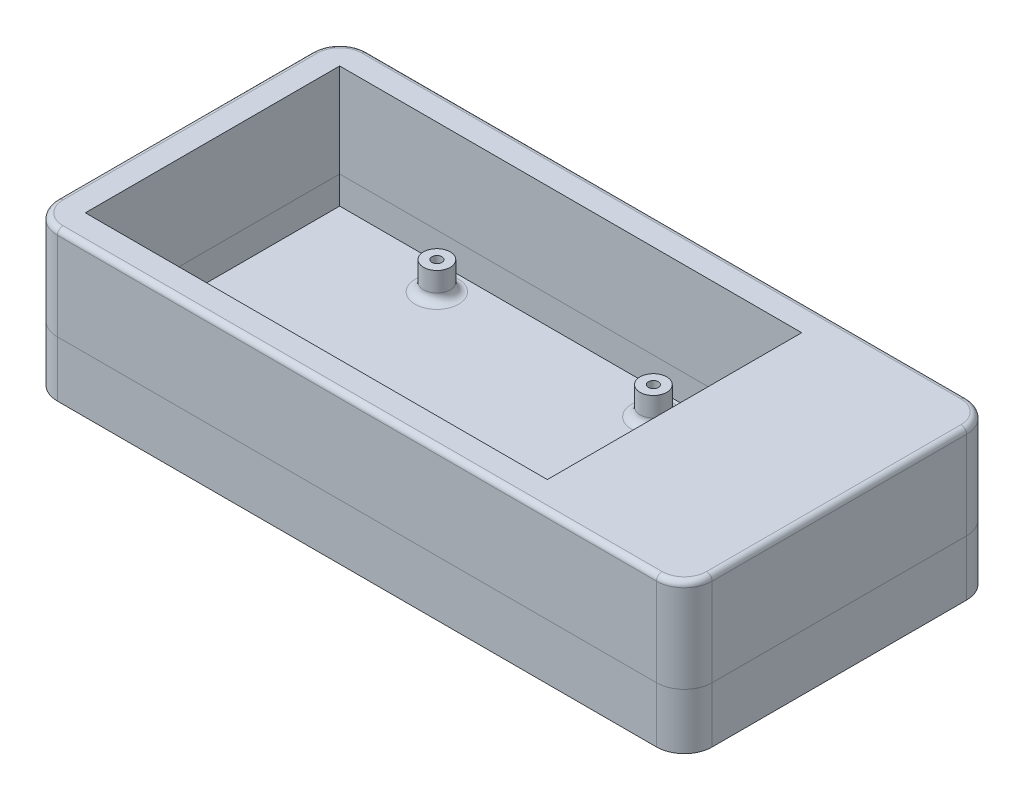
from build123d import *

# Parameters (mm, degrees)
BOSS_EXTRUDE2_DEPTH    = 26.8
SKETCH2_W              = 107.6
SKETCH2_H              = 45.69
CUT_EXTRUDE2_DEPTH     = 21.8
SKETCH3_R              = 2.4
SKETCH3_R_2            = 0.9
BOSS_EXTRUDE3_DEPTH    = 5
FILLET3_R              = 1
FILLET5_R              = 1.5
FILLET6_R              = 1.5
FILLET7_R              = 1.5
BOSS_EXTRUDE4_REACH    = 91.152
SKETCH10_W             = 24.61
SKETCH10_H             = 5
CUT_EXTRUDE3_DEPTH     = 5
SPLIT1_SURFACE_1_BACK  = 133.851
SPLIT1_SURFACE_1_DEPTH = 267.702
SPLIT1_SURFACE_2_BACK  = 133.851
SPLIT1_SURFACE_2_DEPTH = 267.702


with BuildPart() as part:
    # Sketch1 → Boss-Extrude2 (new body)
    with BuildSketch(Plane(origin=(0, 0, 0), x_dir=(1, 0, 0), z_dir=(0, 1, 0))):
        with BuildLine():
            Line((-44.333718436, 25.104825802), (63.266281564, 25.104825802))
            ThreePointArc((63.266281564, 25.104825802), (66.80181547, 23.640359708), (68.266281564, 20.104825802))
            Line((68.266281564, 20.104825802), (68.266281564, -25.585174198))
            ThreePointArc((68.266281564, -25.585174198), (66.80181547, -29.120708104), (63.266281564, -30.585174198))
            Line((63.266281564, -30.585174198), (-44.333718436, -30.585174198))
            ThreePointArc((-44.333718436, -30.585174198), (-47.869252342, -29.120708104), (-49.333718436, -25.585174198))
            Line((-49.333718436, -25.585174198), (-49.333718436, 20.104825802))
            ThreePointArc((-49.333718436, 20.104825802), (-47.869252342, 23.640359708), (-44.333718436, 25.104825802))
        make_face()
    extrude(amount=BOSS_EXTRUDE2_DEPTH)

    # Sketch2 → Cut-Extrude2 (cut)
    with BuildSketch(Plane(origin=(0, 26.8, 0), x_dir=(1, 0, 0), z_dir=(0, 1, 0))):
        with Locations((9.466281564, -2.740174198)):
            Rectangle(SKETCH2_W, SKETCH2_H)
    extrude(amount=-CUT_EXTRUDE2_DEPTH, mode=Mode.SUBTRACT)

    # Sketch3 → Boss-Extrude3 (add)
    # profile 1 of 3: a face of its own
    with BuildSketch(Plane(origin=(0, 5, 0), x_dir=(1, 0, 0), z_dir=(0, 1, 0))):
        with Locations((-22.283718436, 15.514825802)):
            Circle(SKETCH3_R)
        with Locations((-22.283718436, 15.514825802)):
            Circle(SKETCH3_R_2, mode=Mode.SUBTRACT)
    # profile 2 of 3: a face of its own
    with BuildSketch(Plane(origin=(0, 5, 0), x_dir=(1, 0, 0), z_dir=(0, 1, 0))):
        with Locations((16.606281564, 15.514825802)):
            Circle(SKETCH3_R)
        with Locations((16.606281564, 15.514825802)):
            Circle(SKETCH3_R_2, mode=Mode.SUBTRACT)
    # profile 3 of 3: a face of its own
    with BuildSketch(Plane(origin=(0, 5, 0), x_dir=(1, 0, 0), z_dir=(0, 1, 0))):
        with Locations((-2.443718436, -20.995174198)):
            Circle(SKETCH3_R)
        with Locations((-2.443718436, -20.995174198)):
            Circle(SKETCH3_R_2, mode=Mode.SUBTRACT)
    extrude(amount=BOSS_EXTRUDE3_DEPTH)

    # Fillet3
    fillet3_edges = [part.edges().sort_by_distance(p)[0] for p in [
        (-47.869252342, 26.8, 29.120708104),
        (-47.869252342, 26.8, -23.640359708),
        (66.80181547, 26.8, -23.640359708),
        (66.80181547, 26.8, 29.120708104),
        (9.466281564, 26.8, -25.104825802),
        (-49.333718436, 26.8, 2.740174198),
        (68.266281564, 26.8, 2.740174198),
        (9.466281564, 26.8, 30.585174198),
    ]]
    fillet(fillet3_edges, radius=FILLET3_R)

    # Fillet5
    fillet5_edges = [part.edges().sort_by_distance(p)[0] for p in [
        (14.206281564, 5, -15.514825802),
    ]]
    fillet(fillet5_edges, radius=FILLET5_R)

    # Fillet6
    fillet6_edges = [part.edges().sort_by_distance(p)[0] for p in [
        (-24.683718436, 5, -15.514825802),
    ]]
    fillet(fillet6_edges, radius=FILLET6_R)

    # Fillet7
    fillet7_edges = [part.edges().sort_by_distance(p)[0] for p in [
        (-4.843718436, 5, 20.995174198),
    ]]
    fillet(fillet7_edges, radius=FILLET7_R)

    # Sketch10 → Boss-Extrude4 (add, up to next)
    with BuildSketch(Plane.XY.offset(-20.104825802), mode=Mode.PRIVATE) as boss_extrude4_sk1:
        with Locations((50.961281564, 24.3)):
            Rectangle(SKETCH10_W, SKETCH10_H)
    boss_extrude4_tool1 = extrude(boss_extrude4_sk1.sketch, amount=BOSS_EXTRUDE4_REACH, mode=Mode.PRIVATE) - part.part
    add(boss_extrude4_tool1.solids().sort_by_distance((50.961282, 24.3, -20.104826))[0])

    # Sketch13 → Cut-Extrude3 (cut)
    with BuildSketch(Plane.XY.offset(-20.104825802)):
        with BuildLine():
            Line((42.126281564, 11), (52.626281564, 11))
            ThreePointArc((52.626281564, 11), (52.979834955, 10.853553391), (53.126281564, 10.5))
            Line((53.126281564, 10.5), (53.126281564, 7.2))
            ThreePointArc((53.126281564, 7.2), (52.979834955, 6.846446609), (52.626281564, 6.7))
            Line((52.626281564, 6.7), (42.126281564, 6.7))
            ThreePointArc((42.126281564, 6.7), (41.772728174, 6.846446609), (41.626281564, 7.2))
            Line((41.626281564, 7.2), (41.626281564, 10.5))
            ThreePointArc((41.626281564, 10.5), (41.772728174, 10.853553391), (42.126281564, 11))
        make_face()
    extrude(amount=-CUT_EXTRUDE3_DEPTH, mode=Mode.SUBTRACT)


with BuildPart() as body_2:
    # Split1: the piece behind the surface
    add(part.part)
    # Split1 surface: a surface, the sketch's curves swept straight by 267.702 mm
    with BuildLine(Plane.XY.offset(-20.104825802).offset(-SPLIT1_SURFACE_1_BACK), mode=Mode.PRIVATE) as split1_surface_1_path:
        Line((-49.333718436, 10), (68.266281564, 10))
    split1_surface_1 = Shell.extrude(split1_surface_1_path.wire(), (0 * SPLIT1_SURFACE_1_DEPTH, 0 * SPLIT1_SURFACE_1_DEPTH, 1 * SPLIT1_SURFACE_1_DEPTH))
    split(bisect_by=split1_surface_1, keep=Keep.BOTTOM)


with BuildPart() as part_1:
    add(part.part)

    # Split1: split by a surface, the side it looks to stays
    # Split1 surface: a surface, the sketch's curves swept straight by 267.702 mm
    with BuildLine(Plane.XY.offset(-20.104825802).offset(-SPLIT1_SURFACE_2_BACK), mode=Mode.PRIVATE) as split1_surface_2_path:
        Line((-49.333718436, 10), (68.266281564, 10))
    split1_surface_2 = Shell.extrude(split1_surface_2_path.wire(), (0 * SPLIT1_SURFACE_2_DEPTH, 0 * SPLIT1_SURFACE_2_DEPTH, 1 * SPLIT1_SURFACE_2_DEPTH))
    split(bisect_by=split1_surface_2, keep=Keep.TOP)


solid = Compound([body_2.part, part_1.part])
